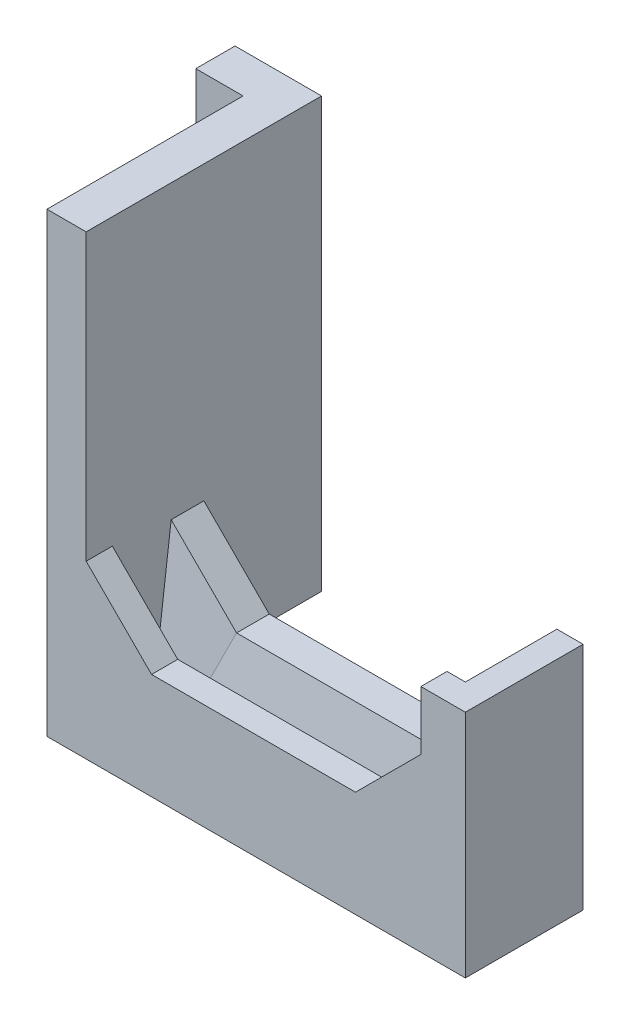
from build123d import *

# Parameters (mm, degrees)
SKETCH_1_R       = 2
EXTRUDE_1_DEPTH  = 3
EXTRUDE_2_DEPTH  = 15
SKETCH_3_W       = 2
SKETCH_3_H       = 6
EXTRUDE_3_DEPTH  = 29
SKETCH_5_W       = 2
SKETCH_5_H       = 6
EXTRUDE_4_DEPTH  = 7
SKETCH_6_W       = 32
SKETCH_6_H       = 7
EXTRUDE_5_DEPTH  = 2
CHAMFER_1_SIZE   = 5
SKETCH_8_W       = 32
SKETCH_8_H       = 2.104912686
EXTRUDE_6_DEPTH  = 7
SKETCH_9_W       = 27
SKETCH_9_H       = 4.5
EXTRUDE_7_DEPTH  = 5.5
CHAMFER_2_SIZE   = 5
EXTRUDE_8_DEPTH  = 9.5
CHAMFER_3_SIZE   = 5
CHAMFER_4_SIZE   = 3
CHAMFER_6_SIZE   = 2
CHAMFER_6_SIZE_2 = 11.342563639


with BuildPart() as part:
    # 草图1 → 凸台-拉伸1 (new body)
    with BuildSketch(Plane.XY):
        with BuildLine():
            Line((-22.344972157, 75.303248777), (-15.102670088, 80.384719944))
            Line((-15.102670088, 80.384719944), (-15.102670088, 113.200215401))
            Line((-15.102670088, 113.200215401), (-21.718999147, 113.200215401))
            Line((-21.718999147, 113.200215401), (-21.718999147, 103.843357559))
            ThreePointArc((-21.718999147, 103.843357559), (-22.903426745, 100.983896387), (-25.762887917, 99.799468789))
            Line((-25.762887917, 99.799468789), (-29.17448261, 99.799468789))
            Line((-29.17448261, 99.799468789), (-29.17448261, 97.102223458))
            Line((-29.17448261, 97.102223458), (-30.762887917, 97.102223458))
            Line((-30.762887917, 97.102223458), (-30.762887917, 88.952611989))
            Line((-30.762887917, 88.952611989), (-30.762887917, 78.952611989))
            ThreePointArc((-30.762887917, 78.952611989), (-27.751659045, 74.365151973), (-22.344972157, 75.303248777))
        make_face()
        with Locations((-25.762887917, 88.952611989)):
            Circle(SKETCH_1_R, mode=Mode.SUBTRACT)
        with Locations((-25.762887917, 78.952611989)):
            Circle(SKETCH_1_R, mode=Mode.SUBTRACT)
    extrude(amount=EXTRUDE_1_DEPTH)

    # 草图2 → 凸台-拉伸2 (add)
    with BuildSketch(Plane.XY.offset(3)):
        Polygon((-18.102670088, 80.384719944), (-18.102670088, 78.279807258), (-15.102670088, 80.384719944), (-15.102670088, 113.200215401), (-18.102670088, 113.200215401), align=None)
    extrude(amount=EXTRUDE_2_DEPTH)

    # 草图3 → 凸台-拉伸3 (add)
    with BuildSketch(Plane(origin=(-15.102670088, 0, 0), x_dir=(0, 0, -1), z_dir=(1, 0, 0))):
        with Locations((-17, 83.384719944)):
            Rectangle(SKETCH_3_W, SKETCH_3_H)
    extrude(amount=EXTRUDE_3_DEPTH)

    # 草图5 → 凸台-拉伸4 (add)
    with BuildSketch(Plane(origin=(0, 0, 16), x_dir=(-1, 0, 0), z_dir=(0, 0, -1))):
        with Locations((-12.897329912, 83.384719944)):
            Rectangle(SKETCH_5_W, SKETCH_5_H)
    extrude(amount=EXTRUDE_4_DEPTH)

    # 草图6 → 凸台-拉伸5 (add)
    with BuildSketch(Plane.XY.offset(18)):
        with Locations((-2.102670088, 81.779807258)):
            Rectangle(SKETCH_6_W, SKETCH_6_H)
    extrude(amount=-EXTRUDE_5_DEPTH)

    # 倒角1
    chamfer_1_edges = [part.edges().sort_by_distance(p)[0] for p in [
        (-15.102670088, 86.384719944, 17),
    ]]
    chamfer(chamfer_1_edges, length=CHAMFER_1_SIZE)

    # 草图8 → 凸台-拉伸6 (add)
    with BuildSketch(Plane(origin=(0, 0, 16), x_dir=(-1, 0, 0), z_dir=(0, 0, -1))):
        with Locations((2.102670088, 79.332263601)):
            Rectangle(SKETCH_8_W, SKETCH_8_H)
    extrude(amount=EXTRUDE_6_DEPTH)

    # 草图9 → 凸台-拉伸7 (add)
    with BuildSketch(Plane(origin=(0, 80.384719944, 0), x_dir=(1, 0, 0), z_dir=(0, 1, 0))):
        with Locations((-1.602670088, -11.25)):
            Rectangle(SKETCH_9_W, SKETCH_9_H)
    extrude(amount=EXTRUDE_7_DEPTH)

    # 倒角2
    chamfer_2_edges = [part.edges().sort_by_distance(p)[0] for p in [
        (-15.102670088, 85.884719944, 11.25),
    ]]
    chamfer(chamfer_2_edges, length=CHAMFER_2_SIZE)

    # 草图10 → 凸台-拉伸8 (add)
    with BuildSketch(Plane(origin=(0, 86.384719944, 0), x_dir=(1, 0, 0), z_dir=(0, 1, 0))):
        Polygon((11.897329912, -9), (11.897329912, -16), (10.494123617, -16), (10.494123617, -18), (11.897329912, -18), (13.897329912, -18), (13.897329912, -9), align=None)
    extrude(amount=EXTRUDE_8_DEPTH)

    # 倒角3
    chamfer_3_edges = [part.edges().sort_by_distance(p)[0] for p in [
        (10.494123617, 86.384719944, 17),
    ]]
    chamfer(chamfer_3_edges, length=CHAMFER_3_SIZE)

    # 倒角4
    chamfer_4_edges = [part.edges().sort_by_distance(p)[0] for p in [
        (11.897329912, 85.884719944, 11.25),
    ]]
    chamfer(chamfer_4_edges, length=CHAMFER_4_SIZE)

    # 倒角6
    # the kernel refuses this chamfer: 11.342563639, 2 mm, written as the material it takes off along each edge
    with BuildSketch(Plane(origin=(-35.944000175, 111.726050031, 13.5), x_dir=(0, 0, -1), z_dir=(0.7071067811865472, -0.7071067811865478, 0))) as chamfer_6_piece_1_section:
        Polygon((CHAMFER_6_SIZE, 0), (0, -CHAMFER_6_SIZE_2), (0, 0), align=None)
    chamfer_6_piece_1 = extrude(amount=66.019251147, mode=Mode.PRIVATE)
    chamfer_6_piece_1 = split(chamfer_6_piece_1, bisect_by=Plane(origin=(-15.102670088, 111.726050031, 13.5), z_dir=(1, 0, 0)), keep=Keep.TOP, mode=Mode.PRIVATE)
    chamfer_6_piece_1 = split(chamfer_6_piece_1, bisect_by=Plane(origin=(-35.944000175, 80.384719944, 13.5), z_dir=(0, 1, 0)), keep=Keep.TOP, mode=Mode.PRIVATE)
    chamfer_6_piece_1 = split(chamfer_6_piece_1, bisect_by=Plane(origin=(-35.944000175, 110.604818441, 7.141179669), z_dir=(0, 0.17364817766692733, 0.9848077530122086)), keep=Keep.TOP, mode=Mode.PRIVATE)
    add(chamfer_6_piece_1, mode=Mode.SUBTRACT)
    with BuildSketch(Plane(origin=(-39.576761755, 85.884719944, 13.5), x_dir=(0, 0, -1), z_dir=(1, 0, 0))) as chamfer_6_piece_2_section:
        Polygon((CHAMFER_6_SIZE, 0), (0, -CHAMFER_6_SIZE_2), (0, 0), align=None)
    chamfer_6_piece_2 = extrude(amount=77.948183335, mode=Mode.PRIVATE)
    chamfer_6_piece_2 = split(chamfer_6_piece_2, bisect_by=Plane(origin=(11.897329912, 85.884719944, 13.5), z_dir=(-1, 0, 0)), keep=Keep.TOP, mode=Mode.PRIVATE)
    chamfer_6_piece_2 = split(chamfer_6_piece_2, bisect_by=Plane(origin=(-15.102670088, 85.884719944, 13.5), z_dir=(1, 0, 0)), keep=Keep.TOP, mode=Mode.PRIVATE)
    chamfer_6_piece_2 = split(chamfer_6_piece_2, bisect_by=Plane(origin=(-39.576761755, 80.384719944, 13.5), z_dir=(0, 1, 0)), keep=Keep.TOP, mode=Mode.PRIVATE)
    chamfer_6_piece_2 = split(chamfer_6_piece_2, bisect_by=Plane(origin=(-39.374230212, 86.087251487, 15.124384731), z_dir=(0.12278780396897075, 0.12278780396897053, 0.9848077530122088)), keep=Keep.TOP, mode=Mode.PRIVATE)
    chamfer_6_piece_2 = split(chamfer_6_piece_2, bisect_by=Plane(origin=(-38.604080635, 84.912038824, 5.698704782), z_dir=(-0.12278780396897096, 0.12278780396897111, 0.9848077530122086)), keep=Keep.TOP, mode=Mode.PRIVATE)
    add(chamfer_6_piece_2, mode=Mode.SUBTRACT)
    with BuildSketch(Plane(origin=(32.73866, 109.726050031, 13.5), x_dir=(0.7071067811865475, -0.7071067811865475, 0), z_dir=(-0.7071067811865476, -0.7071067811865476, 0))) as chamfer_6_piece_3_section:
        Polygon((CHAMFER_6_SIZE_2, 0), (0, -CHAMFER_6_SIZE), (0, 0), align=None)
    chamfer_6_piece_3 = extrude(amount=63.190824022, mode=Mode.PRIVATE)
    chamfer_6_piece_3 = split(chamfer_6_piece_3, bisect_by=Plane(origin=(11.897329912, 109.726050031, 13.5), z_dir=(-1, 0, 0)), keep=Keep.TOP, mode=Mode.PRIVATE)
    chamfer_6_piece_3 = split(chamfer_6_piece_3, bisect_by=Plane(origin=(32.73866, 80.384719944, 13.5), z_dir=(0, 1, 0)), keep=Keep.TOP, mode=Mode.PRIVATE)
    chamfer_6_piece_3 = split(chamfer_6_piece_3, bisect_by=Plane(origin=(32.73866, 108.665125821, 7.483199812), z_dir=(0, 0.17364817766692733, 0.9848077530122086)), keep=Keep.TOP, mode=Mode.PRIVATE)
    add(chamfer_6_piece_3, mode=Mode.SUBTRACT)


solid = part.part
